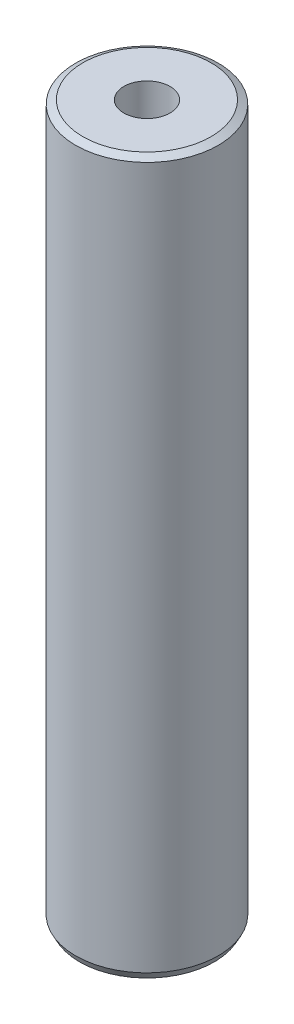
from build123d import *
from OCP.BRepFilletAPI import BRepFilletAPI_MakeChamfer

# Parameters (mm, degrees)
SKETCH1_R           = 60
BOSS_EXTRUDE1_DEPTH = 600
SKETCH2_R           = 19.428840851
CUT_EXTRUDE1_DEPTH  = 606.970296302
CHAMFER1_SIZE       = 3.268320821
CHAMFER1_SIZE2      = 6.07572762


with BuildPart() as part:
    # Sketch1 → Boss-Extrude1 (new body)
    with BuildSketch(Plane(origin=(0, 0, 0), x_dir=(1, 0, 0), z_dir=(0, 1, 0))):
        Circle(SKETCH1_R)
    extrude(amount=BOSS_EXTRUDE1_DEPTH)

    # Sketch2 → Cut-Extrude1 (cut, through all)
    with BuildSketch(Plane(origin=(0, 0, 0), x_dir=(1, 0, 0), z_dir=(0, 1, 0))):
        Circle(SKETCH2_R)
    extrude(amount=CUT_EXTRUDE1_DEPTH, mode=Mode.SUBTRACT)

    # Chamfer1: one chamfer whose edges measure the first distance from different faces: ONE call of the kernel's chamfer builder (chamfer() names one face for all edges)
    chamfer1_edges_1 = [part.edges().sort_by_distance(p)[0] for p in [
        (-60, 600, 0),
    ]]
    chamfer1_side_1 = [part.faces().sort_by_distance(p)[0] for p in [
        (-60, 300, 0),
    ]]
    chamfer1_edges_2 = [part.edges().sort_by_distance(p)[0] for p in [
        (-60, 0, 0),
    ]]
    chamfer1_side_2 = [part.faces().sort_by_distance(p)[0] for p in [
        (-58.302943725, 0, 0),
    ]]
    chamfer1 = BRepFilletAPI_MakeChamfer(part.part.solid().wrapped)
    for e in chamfer1_edges_1:
        chamfer1.Add(CHAMFER1_SIZE, CHAMFER1_SIZE2, e.wrapped, chamfer1_side_1[0].wrapped)  # the first distance lies on this face
    for e in chamfer1_edges_2:
        chamfer1.Add(CHAMFER1_SIZE, CHAMFER1_SIZE2, e.wrapped, chamfer1_side_2[0].wrapped)  # the first distance lies on this face
    add(Compound.cast(chamfer1.Shape()), mode=Mode.REPLACE)


solid = part.part
